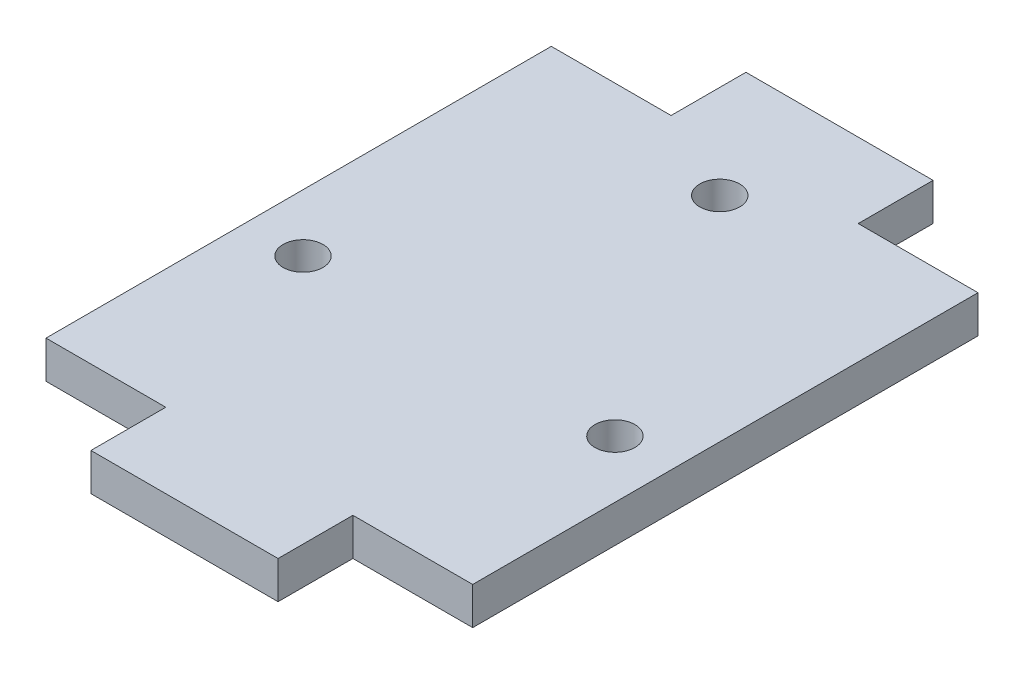
from build123d import *

# Parameters (mm, degrees)
ESBO_O1_R                = 1.6
RESSALTO_EXTRUS_O1_DEPTH = 3


with BuildPart() as part:
    # Esboço1 → Ressalto-extrusão1 (new body)
    with BuildSketch(Plane.XZ.offset(6)):
        Polygon((17.1, 36.9), (7.5, 36.9), (7.5, 42.9), (-7.5, 42.9), (-7.5, 36.9), (-17.1, 36.9), (-17.1, -3.6), (-7.5, -3.6), (-7.5, -9.6), (7.5, -9.6), (7.5, -3.6), (17.1, -3.6), align=None)
        with Locations((-12.5, 20.9)):
            Circle(ESBO_O1_R, mode=Mode.SUBTRACT)
        Circle(ESBO_O1_R, mode=Mode.SUBTRACT)
        with Locations((12.5, 20.9)):
            Circle(ESBO_O1_R, mode=Mode.SUBTRACT)
    extrude(amount=-RESSALTO_EXTRUS_O1_DEPTH)


solid = part.part
